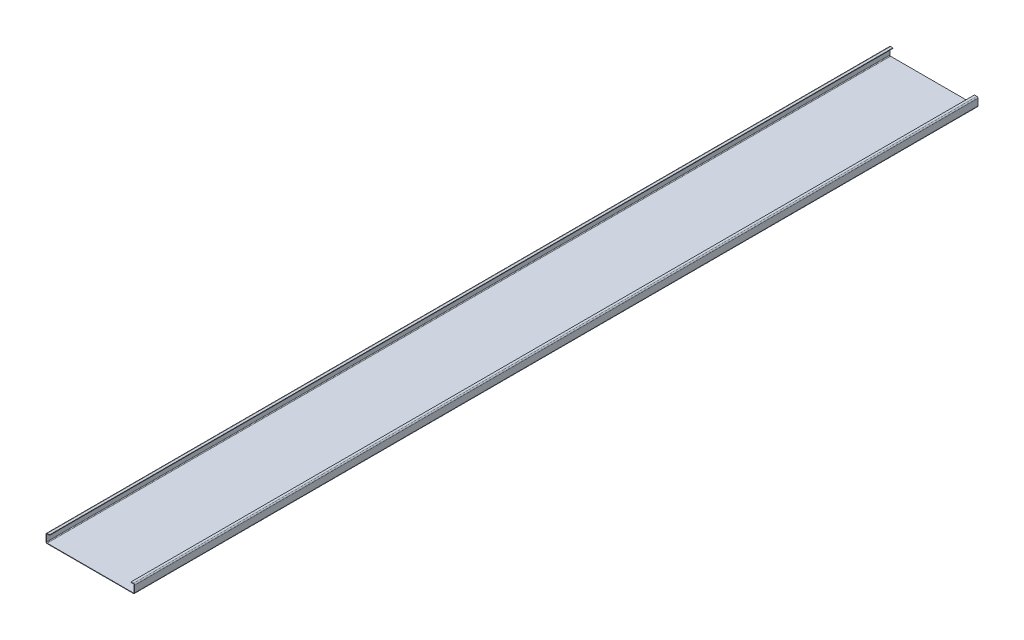
from build123d import *

# Parameters (mm, degrees)
BASE_FLANGE1_DEPTH = 2380


# Sheet-metal steps are written as plain solids
with BuildPart() as part:
    # Sketch1 → Base-Flange1 (new body)
    with BuildSketch(Plane.XY):
        with BuildLine():
            Line((10, 25), (3.25, 25))
            ThreePointArc((3.25, 25), (0.951902961, 24.048097039), (0, 21.75))
            Line((0, 21.75), (0, 3.25))
            ThreePointArc((0, 3.25), (0.951902961, 0.951902961), (3.25, 0))
            Line((3.25, 0), (246.75, 0))
            ThreePointArc((246.75, 0), (249.048097039, 0.951902961), (250, 3.25))
            Line((250, 3.25), (250, 21.75))
            ThreePointArc((250, 21.75), (249.048097039, 24.048097039), (246.75, 25))
            Line((246.75, 25), (240, 25))
            Line((240, 25), (240, 23.75))
            Line((240, 23.75), (246.75, 23.75))
            ThreePointArc((246.75, 23.75), (248.164213562, 23.164213562), (248.75, 21.75))
            Line((248.75, 21.75), (248.75, 3.25))
            ThreePointArc((248.75, 3.25), (248.164213562, 1.835786438), (246.75, 1.25))
            Line((246.75, 1.25), (3.25, 1.25))
            ThreePointArc((3.25, 1.25), (1.835786438, 1.835786438), (1.25, 3.25))
            Line((1.25, 3.25), (1.25, 21.75))
            ThreePointArc((1.25, 21.75), (1.835786438, 23.164213562), (3.25, 23.75))
            Line((3.25, 23.75), (10, 23.75))
            Line((10, 23.75), (10, 25))
        make_face()
    extrude(amount=BASE_FLANGE1_DEPTH)


solid = part.part
